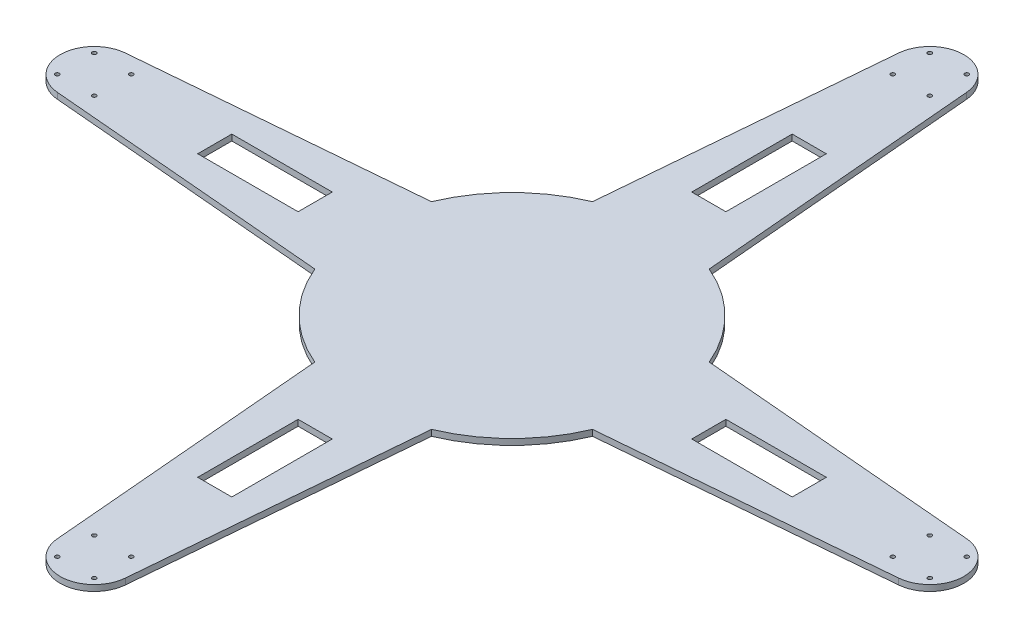
from build123d import *

# Parameters (mm, degrees)
SKETCH1_R               = 1
BOSS_EXTRUDE1_DEPTH     = 3
SKETCH2_W               = 50
SKETCH2_H               = 17
CUT_EXTRUDE1_DEPTH      = 178.476759042
SKETCH3_R               = 75
BOSS_EXTRUDE2_DEPTH     = 3
CIRPATTERN1_OUTLINE_R   = 1
CIRPATTERN1_OUTLINE_W   = 17
CIRPATTERN1_OUTLINE_H   = 50
CIRPATTERN1_OUTLINE_W_2 = 50
CIRPATTERN1_OUTLINE_H_2 = 17
CIRPATTERN1_DEPTH       = 3


# Read off the part's stored shape, not the designer's step: CirPattern1
with BuildPart() as part:
    # Sketch1 → Boss-Extrude1 (new body)
    with BuildSketch(Plane(origin=(0, 0, 0), x_dir=(1, 0, 0), z_dir=(0, 1, 0))):
        with BuildLine():
            Line((0, 0), (151.460758228, 13.062875527))
            ThreePointArc((151.460758228, 13.062875527), (167, 30), (151.460758228, 46.937124473))
            Line((151.460758228, 46.937124473), (0, 60))
            Line((0, 60), (0, 0))
        make_face()
        with Locations(Location((140.807611845, 39.192388155, 0), (0, 0, 270))):
            Circle(SKETCH1_R, mode=Mode.SUBTRACT)
        with Locations(Location((140.807611845, 20.807611845, 0), (0, 0, 270))):
            Circle(SKETCH1_R, mode=Mode.SUBTRACT)
        with Locations(Location((159.192388155, 20.807611845, 0), (0, 0, 270))):
            Circle(SKETCH1_R, mode=Mode.SUBTRACT)
        with Locations(Location((159.192388155, 39.192388155, 0), (0, 0, 270))):
            Circle(SKETCH1_R, mode=Mode.SUBTRACT)
    extrude(amount=BOSS_EXTRUDE1_DEPTH)

    # Sketch2 → Cut-Extrude1 (cut, through all)
    with BuildSketch(Plane(origin=(0, 3, 0), x_dir=(1, 0, 0), z_dir=(0, 1, 0))):
        with Locations((65, 30)):
            Rectangle(SKETCH2_W, SKETCH2_H)
    extrude(amount=-CUT_EXTRUDE1_DEPTH, mode=Mode.SUBTRACT)

    # Sketch3 → Boss-Extrude2 (add)
    with BuildSketch(Plane(origin=(0, 3, 0), x_dir=(1, 0, 0), z_dir=(0, 1, 0))):
        with Locations((-58, 30)):
            Circle(SKETCH3_R)
    extrude(amount=-BOSS_EXTRUDE2_DEPTH)

    # CirPattern1 outline → CirPattern1 (add)
    # profile 1 of 3: a face of its own
    with BuildSketch(Plane(origin=(0, 0, 0), x_dir=(1, 0, 0), z_dir=(0, 1, 0))):
        with BuildLine():
            ThreePointArc((-28.961675415, -39.150384708), (-58, -45), (-87.038324585, -39.150384708))
            Line((-87.038324585, -39.150384708), (-74.937124473, -179.460758228))
            ThreePointArc((-74.937124473, -179.460758228), (-58, -195), (-41.062875527, -179.460758228))
            Line((-41.062875527, -179.460758228), (-28.961675415, -39.150384708))
        make_face()
        with Locations((-67.192388155, -187.192388155)):
            Circle(CIRPATTERN1_OUTLINE_R, mode=Mode.SUBTRACT)
        with Locations((-67.192388155, -168.807611845)):
            Circle(CIRPATTERN1_OUTLINE_R, mode=Mode.SUBTRACT)
        with Locations((-48.807611845, -187.192388155)):
            Circle(CIRPATTERN1_OUTLINE_R, mode=Mode.SUBTRACT)
        with Locations((-48.807611845, -168.807611845)):
            Circle(CIRPATTERN1_OUTLINE_R, mode=Mode.SUBTRACT)
        with Locations((-58, -93)):
            Rectangle(CIRPATTERN1_OUTLINE_W, CIRPATTERN1_OUTLINE_H, mode=Mode.SUBTRACT)
    # profile 2 of 3: a face of its own
    with BuildSketch(Plane(origin=(0, 0, 0), x_dir=(1, 0, 0), z_dir=(0, 1, 0))):
        with BuildLine():
            ThreePointArc((-127.150384708, 0.961675415), (-133, 30), (-127.150384708, 59.038324585))
            Line((-127.150384708, 59.038324585), (-267.460758228, 46.937124473))
            ThreePointArc((-267.460758228, 46.937124473), (-283, 30), (-267.460758228, 13.062875527))
            Line((-267.460758228, 13.062875527), (-127.150384708, 0.961675415))
        make_face()
        with Locations((-275.192388155, 20.807611845)):
            Circle(CIRPATTERN1_OUTLINE_R, mode=Mode.SUBTRACT)
        with Locations((-256.807611845, 20.807611845)):
            Circle(CIRPATTERN1_OUTLINE_R, mode=Mode.SUBTRACT)
        with Locations((-275.192388155, 39.192388155)):
            Circle(CIRPATTERN1_OUTLINE_R, mode=Mode.SUBTRACT)
        with Locations((-256.807611845, 39.192388155)):
            Circle(CIRPATTERN1_OUTLINE_R, mode=Mode.SUBTRACT)
        with Locations((-181, 30)):
            Rectangle(CIRPATTERN1_OUTLINE_W_2, CIRPATTERN1_OUTLINE_H_2, mode=Mode.SUBTRACT)
    # profile 3 of 3: a face of its own
    with BuildSketch(Plane(origin=(0, 0, 0), x_dir=(1, 0, 0), z_dir=(0, 1, 0))):
        with BuildLine():
            ThreePointArc((-41.062875527, 239.460758228), (-58, 255), (-74.937124473, 239.460758228))
            Line((-74.937124473, 239.460758228), (-87.038324585, 99.150384708))
            ThreePointArc((-87.038324585, 99.150384708), (-58, 105), (-28.961675415, 99.150384708))
            Line((-28.961675415, 99.150384708), (-41.062875527, 239.460758228))
        make_face()
        with Locations((-58, 153)):
            Rectangle(CIRPATTERN1_OUTLINE_W, CIRPATTERN1_OUTLINE_H, mode=Mode.SUBTRACT)
        with Locations((-67.192388155, 228.807611845)):
            Circle(CIRPATTERN1_OUTLINE_R, mode=Mode.SUBTRACT)
        with Locations((-67.192388155, 247.192388155)):
            Circle(CIRPATTERN1_OUTLINE_R, mode=Mode.SUBTRACT)
        with Locations((-48.807611845, 228.807611845)):
            Circle(CIRPATTERN1_OUTLINE_R, mode=Mode.SUBTRACT)
        with Locations((-48.807611845, 247.192388155)):
            Circle(CIRPATTERN1_OUTLINE_R, mode=Mode.SUBTRACT)
    extrude(amount=CIRPATTERN1_DEPTH)


solid = part.part
